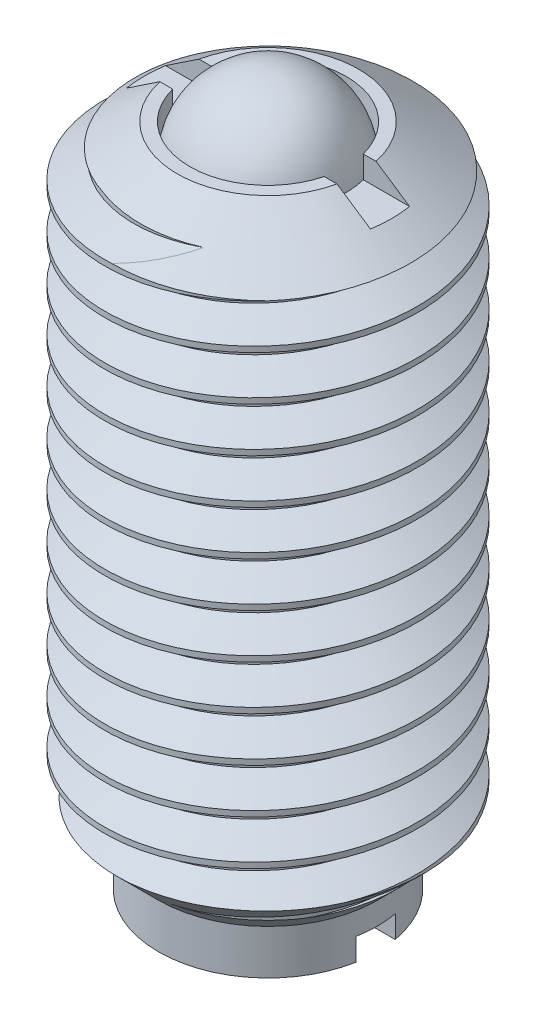
from build123d import *

# Parameters (mm, degrees)
SKETCH24_W               = 3.175
SKETCH24_H               = 13.4874
CUT_SWEEP1_PITCH         = 0.907142857
SKETCH26_W               = 1.5875
SKETCH26_H               = 12.13866
CUT_EXTRUDE11_DEPTH      = 9.101774161
CUT_EXTRUDE11_DEPTH_BACK = 9.101774161
SKETCH28_W               = 0.79375
SKETCH28_H               = 0.453571429


with BuildPart() as part:
    # Sketch24 → Revolve1 (revolve)
    with BuildSketch(Plane(origin=(0, 0, 0), x_dir=(0, 0, -1), z_dir=(1, 0, 0)), mode=Mode.PRIVATE) as revolve1_sk:
        with Locations((1.5875, 0)):
            Rectangle(SKETCH24_W, SKETCH24_H)
    revolve(revolve1_sk.sketch.rotate(Axis((0, 6.7437, 0), (0, -1, 0)), 180), axis=Axis((0, 6.7437, 0), (0, -1, 0)))

    # Cut-Sweep1: the profile of Sketch38 profile screwed along a right-hand helix of 15.868 turns, 8 arcs to a turn; built about Z, then put on its axis
    cut_sweep1_z = Axis((0, 0, 0), (0, 0, 1))
    cut_sweep1_corners = [(3.1753, 0, -0.793923205), (3.1753, 0, 0.000173205), (2.585793431, 0, -0.340178571), (2.585793431, 0, -0.453571429)]
    with BuildLine(mode=Mode.PRIVATE) as cut_sweep1_profile:
        Line(cut_sweep1_corners[0], cut_sweep1_corners[1])
        Line(cut_sweep1_corners[1], cut_sweep1_corners[2])
        Line(cut_sweep1_corners[2], cut_sweep1_corners[3])
        Line(cut_sweep1_corners[3], cut_sweep1_corners[0])
    cut_sweep1_cap = Face(cut_sweep1_profile.wire())
    cut_sweep1_turn_angles = [0, 22.5, 45, 67.5, 90, 112.5, 135, 157.5, 180, 202.5, 225, 247.5, 270, 292.5, 315, 337.5, 360]
    cut_sweep1_turn_weights = [1, 0.9238795325112867, 1, 0.9238795325112867, 1, 0.9238795325112867, 1, 0.9238795325112867, 1, 0.9238795325112867, 1, 0.9238795325112867, 1, 0.9238795325112867, 1, 0.9238795325112867, 1]
    cut_sweep1_turn_rails = [Edge.make_bspline([Vector(p[0], p[1], 0).rotate(cut_sweep1_z, cut_sweep1_turn_angles[k]) / cut_sweep1_turn_weights[k] + Vector(0, 0, p[2] + CUT_SWEEP1_PITCH * cut_sweep1_turn_angles[k] / 360) for k in range(17)], [0, 0, 0, 1, 1, 2, 2, 3, 3, 4, 4, 5, 5, 6, 6, 7, 7, 8, 8, 8], 2, cut_sweep1_turn_weights) for p in cut_sweep1_corners]
    cut_sweep1_turn_sides = [Face.make_surface_from_curves(cut_sweep1_turn_rails[p[0]], cut_sweep1_turn_rails[p[1]]) for p in [(0, 1), (1, 2), (2, 3), (3, 0)]]
    cut_sweep1_last_angles = [5400, 5422.5, 5445, 5467.5, 5490, 5512.5, 5535, 5557.5, 5580, 5602.5, 5625, 5647.5, 5670, 5691.24, 5712.48]
    cut_sweep1_last_weights = [1, 0.9238795325112867, 1, 0.9238795325112867, 1, 0.9238795325112867, 1, 0.9238795325112867, 1, 0.9238795325112867, 1, 0.9238795325112867, 1, 0.9320711124580829, 1]
    cut_sweep1_last_rails = [Edge.make_bspline([Vector(p[0], p[1], 0).rotate(cut_sweep1_z, cut_sweep1_last_angles[k]) / cut_sweep1_last_weights[k] + Vector(0, 0, p[2] + CUT_SWEEP1_PITCH * cut_sweep1_last_angles[k] / 360) for k in range(15)], [0, 0, 0, 1, 1, 2, 2, 3, 3, 4, 4, 5, 5, 6, 6, 7, 7, 7], 2, cut_sweep1_last_weights) for p in cut_sweep1_corners]
    cut_sweep1_last_sides = [Face.make_surface_from_curves(cut_sweep1_last_rails[p[0]], cut_sweep1_last_rails[p[1]]) for p in [(0, 1), (1, 2), (2, 3), (3, 0)]]
    cut_sweep1 = Plane(origin=(0, 6.7437, 0), x_dir=(0, 0, 1), z_dir=(0, -1, 0)) * Solid(Shell([*[p.moved(Location((0, 0, CUT_SWEEP1_PITCH * i))) for i in range(15) for p in cut_sweep1_turn_sides], *cut_sweep1_last_sides, cut_sweep1_cap, cut_sweep1_cap.rotate(cut_sweep1_z, 5712.48).moved(Location((0, 0, CUT_SWEEP1_PITCH * 5712.48 / 360)))]))
    add(cut_sweep1, mode=Mode.SUBTRACT)

    # Sketch26 → Cut-Revolve10 (revolve, cut)
    with BuildSketch(Plane(origin=(0, 0, 0), x_dir=(0, 0, -1), z_dir=(1, 0, 0))):
        with Locations((0.79375, 0.67437)):
            Rectangle(SKETCH26_W, SKETCH26_H)
    revolve(axis=Axis((0, -5.39496, 0), (0, 1, 0)), mode=Mode.SUBTRACT)

    # Sketch31 → Cut-Revolve13 (revolve, cut)
    with BuildSketch(Plane(origin=(0, 0, 0), x_dir=(0, 0, -1), z_dir=(1, 0, 0)), mode=Mode.PRIVATE) as cut_revolve13_sk:
        Polygon((3.175, -6.7437), (2.2225, -6.7437), (2.2225, -5.836557143), (3.175, -4.884057143), align=None)
        Polygon((3.175, 6.7437), (1.8415, 6.7437), (3.175, 5.836557143), align=None)
    revolve(cut_revolve13_sk.sketch.rotate(Axis((0, 6.7437, 0), (0, -1, 0)), 180), axis=Axis((0, 6.7437, 0), (0, -1, 0)), mode=Mode.SUBTRACT)

    # Sketch28 → Cut-Extrude11 (cut, two sides: drawn at the far end of the back side and taken through both)
    with BuildSketch(Plane(origin=(0, 0, 0), x_dir=(0, 0, -1), z_dir=(1, 0, 0)).offset(-CUT_EXTRUDE11_DEPTH_BACK)):
        with Locations((0, -6.516914286)):
            Rectangle(SKETCH28_W, SKETCH28_H)
        with Locations((0, 6.516914286)):
            Rectangle(SKETCH28_W, SKETCH28_H)
    extrude(amount=CUT_EXTRUDE11_DEPTH + CUT_EXTRUDE11_DEPTH_BACK, mode=Mode.SUBTRACT)


with BuildPart() as body_2:
    # Sketch27 → Revolve2 (revolve)
    with BuildSketch(Plane(origin=(0, 0, 0), x_dir=(0, 0, -1), z_dir=(1, 0, 0))):
        with BuildLine():
            Line((0, 7.6327), (0, 4.4577))
            ThreePointArc((0, 4.4577), (1.5875, 6.0452), (0, 7.6327))
        make_face()
    revolve(axis=Axis((0, 7.6327, 0), (0, -1, 0)))


solid = Compound([part.part, body_2.part])
